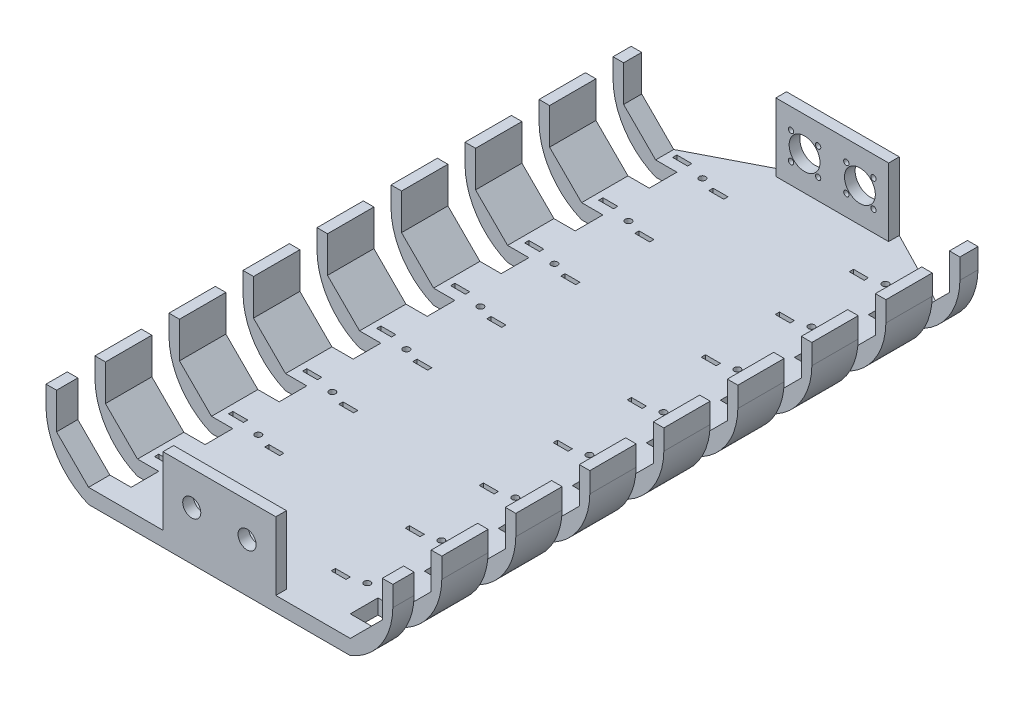
from build123d import *

# Parameters (mm, degrees)
BOSS_EXTRUDE1_DEPTH      = 7
SKETCH2_W                = 123
SKETCH2_H                = 5
BOSS_EXTRUDE2_DEPTH      = 32
SKETCH9_W                = 123
SKETCH9_H                = 7
BOSS_EXTRUDE4_DEPTH      = 5
SKETCH13_W               = 35
SKETCH13_H               = 32
CUT_EXTRUDE5_DEPTH       = 11
BOSS_EXTRUDE10_DEPTH     = 275
BOSS_EXTRUDE13_DEPTH     = 7
SKETCH18_W               = 53
SKETCH18_H               = 5
BOSS_EXTRUDE14_DEPTH     = 32
SKETCH3_R                = 4.25
CUT_EXTRUDE8_DEPTH       = 334
SKETCH19_R               = 7.25
SKETCH19_R_2             = 1.25
CUT_EXTRUDE9_DEPTH       = 334
CUT_EXTRUDE13_DEPTH      = 19
CUT_EXTRUDE16_DEPTH      = 181.638451056
CUT_EXTRUDE16_DEPTH_BACK = 181.638451056
SKETCH32_R               = 1.5
SKETCH32_W               = 30
SKETCH32_H               = 13
SKETCH32_W_2             = 7
SKETCH32_H_2             = 2


with BuildPart() as part:
    # Sketch1 → Boss-Extrude1 (new body)
    with BuildSketch(Plane(origin=(0, 0, 0), x_dir=(1, 0, 0), z_dir=(0, 1, 0))):
        Polygon((-13, 135), (-36, 135), (-61.5, 135), (-61.5, -135), (-36, -135), (-13, -135), (13, -135), (36, -135), (61.5, -135), (61.5, 135), (36, 135), (13, 135), align=None)
    extrude(amount=BOSS_EXTRUDE1_DEPTH)

    # Sketch2 → Boss-Extrude2 (add)
    with BuildSketch(Plane(origin=(0, 7, 0), x_dir=(1, 0, 0), z_dir=(0, 1, 0))):
        with Locations((0, -132.5)):
            Rectangle(SKETCH2_W, SKETCH2_H)
    extrude(amount=BOSS_EXTRUDE2_DEPTH)

    # Sketch9 → Boss-Extrude4 (add)
    with BuildSketch(Plane(origin=(0, 0, -135), x_dir=(-1, 0, 0), z_dir=(0, 0, -1))):
        with Locations((0, 3.5)):
            Rectangle(SKETCH9_W, SKETCH9_H)
    extrude(amount=BOSS_EXTRUDE4_DEPTH)

    # Sketch13 → Cut-Extrude5 (cut)
    with BuildSketch(Plane.XY.offset(135)):
        with Locations((-44, 23)):
            Rectangle(SKETCH13_W, SKETCH13_H)
        with Locations((44, 23)):
            Rectangle(SKETCH13_W, SKETCH13_H)
    extrude(amount=-CUT_EXTRUDE5_DEPTH, mode=Mode.SUBTRACT)

    # Sketch14 → Boss-Extrude10 (add)
    with BuildSketch(Plane.XY.offset(135)):
        with BuildLine():
            Line((-76.55, 22.05), (-61.5, 7))
            Line((-61.5, 7), (-61.5, 0))
            ThreePointArc((-61.5, 0), (-75.904786932, 11.763703775), (-81.5, 29.5))
            Line((-81.5, 29.5), (-81.5, 39))
            Line((-81.5, 39), (-76.55, 39))
            Line((-76.55, 39), (-76.55, 22.05))
        make_face()
        with BuildLine():
            Line((81.5, 39), (76.55, 39))
            Line((76.55, 39), (76.55, 22.05))
            Line((76.55, 22.05), (61.5, 7))
            Line((61.5, 7), (61.5, 0))
            ThreePointArc((61.5, 0), (75.904786932, 11.763703775), (81.5, 29.5))
            Line((81.5, 29.5), (81.5, 39))
        make_face()
    extrude(amount=-BOSS_EXTRUDE10_DEPTH)

    # Sketch17 → Boss-Extrude13 (add)
    with BuildSketch(Plane(origin=(0, 7, 0), x_dir=(1, 0, 0), z_dir=(0, 1, 0))):
        Polygon((-61.5, 140), (-26.5, 226), (0, 226), (26.5, 226), (61.5, 140), align=None)
    extrude(amount=-BOSS_EXTRUDE13_DEPTH)

    # Sketch18 → Boss-Extrude14 (add)
    with BuildSketch(Plane(origin=(0, 7, 0), x_dir=(1, 0, 0), z_dir=(0, 1, 0))):
        with Locations((0, 155.5)):
            Rectangle(SKETCH18_W, SKETCH18_H)
    extrude(amount=BOSS_EXTRUDE14_DEPTH)

    # Sketch3 → Cut-Extrude8 (cut)
    with BuildSketch(Plane.XY.offset(135)):
        with Locations((-13, 23)):
            Circle(SKETCH3_R)
        with Locations((13, 23)):
            Circle(SKETCH3_R)
    extrude(amount=-CUT_EXTRUDE8_DEPTH, mode=Mode.SUBTRACT)

    # Sketch19 → Cut-Extrude9 (cut)
    with BuildSketch(Plane.XY.offset(-153)):
        with Locations((-13, 23)):
            Circle(SKETCH19_R)
        with Locations((-6.636038969, 16.636038969)):
            Circle(SKETCH19_R_2)
        with Locations((-6.636038969, 29.363961031)):
            Circle(SKETCH19_R_2)
        with Locations((-19.363961031, 29.363961031)):
            Circle(SKETCH19_R_2)
        with Locations((-19.363961031, 16.636038969)):
            Circle(SKETCH19_R_2)
        with Locations((13, 23)):
            Circle(SKETCH19_R)
        with Locations((19.363961031, 16.636038969)):
            Circle(SKETCH19_R_2)
        with Locations((6.636038969, 16.636038969)):
            Circle(SKETCH19_R_2)
        with Locations((6.636038969, 29.363961031)):
            Circle(SKETCH19_R_2)
        with Locations((19.363961031, 29.363961031)):
            Circle(SKETCH19_R_2)
    extrude(amount=-CUT_EXTRUDE9_DEPTH, mode=Mode.SUBTRACT)

    # Sketch29 → Cut-Extrude13 (cut)
    with BuildSketch(Plane(origin=(0, 7, 0), x_dir=(1, 0, 0), z_dir=(0, 1, 0))):
        Polygon((-61.5, 140), (-26.5, 158), (26.5, 158), (61.5, 140), (26.5, 226), (-26.5, 226), align=None)
    extrude(amount=-CUT_EXTRUDE13_DEPTH, mode=Mode.SUBTRACT)

    # Sketch32 → Cut-Extrude16 (cut, two sides: drawn at the far end of the back side and taken through both)
    with BuildSketch(Plane(origin=(0, 7, 0), x_dir=(1, 0, 0), z_dir=(0, 1, 0)).offset(-CUT_EXTRUDE16_DEPTH_BACK)):
        with Locations((-43, 135)):
            Circle(SKETCH32_R)
        with Locations((-43, 100.214285714)):
            Circle(SKETCH32_R)
        with Locations((-43, 65.428571429)):
            Circle(SKETCH32_R)
        with Locations((-43, 30.642857143)):
            Circle(SKETCH32_R)
        with Locations((-43, -4.142857143)):
            Circle(SKETCH32_R)
        with Locations((-43, -38.928571429)):
            Circle(SKETCH32_R)
        with Locations((-43, -73.714285714)):
            Circle(SKETCH32_R)
        with Locations((-43, -108.5)):
            Circle(SKETCH32_R)
        with Locations((43, -108.5)):
            Circle(SKETCH32_R)
        with Locations((43, -73.714285714)):
            Circle(SKETCH32_R)
        with Locations((43, -38.928571429)):
            Circle(SKETCH32_R)
        with Locations((43, -4.142857143)):
            Circle(SKETCH32_R)
        with Locations((43, 30.642857143)):
            Circle(SKETCH32_R)
        with Locations((43, 65.428571429)):
            Circle(SKETCH32_R)
        with Locations((43, 100.214285714)):
            Circle(SKETCH32_R)
        with Locations((43, 135)):
            Circle(SKETCH32_R)
        with Locations((-66.5, 125)):
            Rectangle(SKETCH32_W, SKETCH32_H)
        with Locations((-55, 137.5)):
            Rectangle(SKETCH32_W_2, SKETCH32_H_2)
        with Locations((-33, 132.5)):
            Rectangle(SKETCH32_W_2, SKETCH32_H_2)
        with Locations((-66.5, 90.214285714)):
            Rectangle(SKETCH32_W, SKETCH32_H)
        with Locations((-55, 102.714285714)):
            Rectangle(SKETCH32_W_2, SKETCH32_H_2)
        with Locations((-33, 97.714285714)):
            Rectangle(SKETCH32_W_2, SKETCH32_H_2)
        with Locations((-66.5, 55.428571429)):
            Rectangle(SKETCH32_W, SKETCH32_H)
        with Locations((-55, 67.928571429)):
            Rectangle(SKETCH32_W_2, SKETCH32_H_2)
        with Locations((-33, 62.928571429)):
            Rectangle(SKETCH32_W_2, SKETCH32_H_2)
        with Locations((-66.5, 20.642857143)):
            Rectangle(SKETCH32_W, SKETCH32_H)
        with Locations((-55, 33.142857143)):
            Rectangle(SKETCH32_W_2, SKETCH32_H_2)
        with Locations((-33, 28.142857143)):
            Rectangle(SKETCH32_W_2, SKETCH32_H_2)
        with Locations((-66.5, -14.142857143)):
            Rectangle(SKETCH32_W, SKETCH32_H)
        with Locations((-55, -1.642857143)):
            Rectangle(SKETCH32_W_2, SKETCH32_H_2)
        with Locations((-33, -6.642857143)):
            Rectangle(SKETCH32_W_2, SKETCH32_H_2)
        with Locations((-66.5, -48.928571429)):
            Rectangle(SKETCH32_W, SKETCH32_H)
        with Locations((-55, -36.428571429)):
            Rectangle(SKETCH32_W_2, SKETCH32_H_2)
        with Locations((-33, -41.428571429)):
            Rectangle(SKETCH32_W_2, SKETCH32_H_2)
        with Locations((-66.5, -83.714285714)):
            Rectangle(SKETCH32_W, SKETCH32_H)
        with Locations((-55, -71.214285714)):
            Rectangle(SKETCH32_W_2, SKETCH32_H_2)
        with Locations((-33, -76.214285714)):
            Rectangle(SKETCH32_W_2, SKETCH32_H_2)
        with Locations((-66.5, -118.5)):
            Rectangle(SKETCH32_W, SKETCH32_H)
        with Locations((-55, -106)):
            Rectangle(SKETCH32_W_2, SKETCH32_H_2)
        with Locations((-33, -111)):
            Rectangle(SKETCH32_W_2, SKETCH32_H_2)
        with Locations((33, -111)):
            Rectangle(SKETCH32_W_2, SKETCH32_H_2)
        with Locations((55, -106)):
            Rectangle(SKETCH32_W_2, SKETCH32_H_2)
        with Locations((66.5, -118.5)):
            Rectangle(SKETCH32_W, SKETCH32_H)
        with Locations((33, -76.214285714)):
            Rectangle(SKETCH32_W_2, SKETCH32_H_2)
        with Locations((55, -71.214285714)):
            Rectangle(SKETCH32_W_2, SKETCH32_H_2)
        with Locations((66.5, -83.714285714)):
            Rectangle(SKETCH32_W, SKETCH32_H)
        with Locations((33, -41.428571429)):
            Rectangle(SKETCH32_W_2, SKETCH32_H_2)
        with Locations((55, -36.428571429)):
            Rectangle(SKETCH32_W_2, SKETCH32_H_2)
        with Locations((66.5, -48.928571429)):
            Rectangle(SKETCH32_W, SKETCH32_H)
        with Locations((33, -6.642857143)):
            Rectangle(SKETCH32_W_2, SKETCH32_H_2)
        with Locations((55, -1.642857143)):
            Rectangle(SKETCH32_W_2, SKETCH32_H_2)
        with Locations((66.5, -14.142857143)):
            Rectangle(SKETCH32_W, SKETCH32_H)
        with Locations((33, 28.142857143)):
            Rectangle(SKETCH32_W_2, SKETCH32_H_2)
        with Locations((55, 33.142857143)):
            Rectangle(SKETCH32_W_2, SKETCH32_H_2)
        with Locations((66.5, 20.642857143)):
            Rectangle(SKETCH32_W, SKETCH32_H)
        with Locations((33, 62.928571429)):
            Rectangle(SKETCH32_W_2, SKETCH32_H_2)
        with Locations((55, 67.928571429)):
            Rectangle(SKETCH32_W_2, SKETCH32_H_2)
        with Locations((66.5, 55.428571429)):
            Rectangle(SKETCH32_W, SKETCH32_H)
        with Locations((33, 97.714285714)):
            Rectangle(SKETCH32_W_2, SKETCH32_H_2)
        with Locations((55, 102.714285714)):
            Rectangle(SKETCH32_W_2, SKETCH32_H_2)
        with Locations((66.5, 90.214285714)):
            Rectangle(SKETCH32_W, SKETCH32_H)
        with Locations((66.5, 125)):
            Rectangle(SKETCH32_W, SKETCH32_H)
        with Locations((33, 132.5)):
            Rectangle(SKETCH32_W_2, SKETCH32_H_2)
        with Locations((55, 137.5)):
            Rectangle(SKETCH32_W_2, SKETCH32_H_2)
    extrude(amount=CUT_EXTRUDE16_DEPTH + CUT_EXTRUDE16_DEPTH_BACK, mode=Mode.SUBTRACT)


solid = part.part
